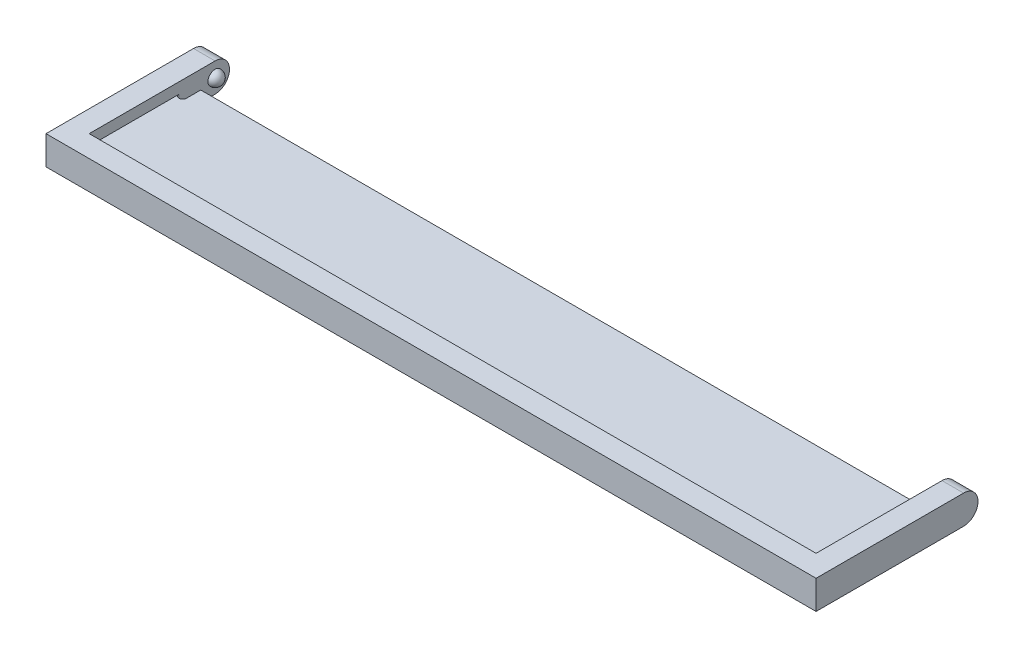
from build123d import *

# Parameters (mm, degrees)
SALIENTE_EXTRUIR1_DEPTH = 4
CROQUIS4_W              = 99
CROQUIS4_H              = 2
CORTAR_EXTRUIR1_DEPTH   = 10
REDONDEO1_R             = 2
CROQUIS5_W              = 101
CROQUIS5_H              = 16.071267716
CORTAR_EXTRUIR2_DEPTH   = 1.5


with BuildPart() as part:
    # Croquis1 → Saliente-Extruir1 (new body)
    with BuildSketch(Plane(origin=(0, 0, 0), x_dir=(1, 0, 0), z_dir=(0, 1, 0))):
        Polygon((-64.683943666, 30.054443615), (36.316056334, 30.054443615), (36.316056334, 33.054443615), (39.316056334, 33.054443615), (39.316056334, 30.054443615), (39.316056334, 10.554443615), (-67.683943666, 10.554443615), (-67.683943666, 30.054443615), (-67.683943666, 33.054443615), (-64.683943666, 33.054443615), align=None)
    extrude(amount=SALIENTE_EXTRUIR1_DEPTH)

    # Croquis4 → Cortar-Extruir1 (cut)
    with BuildSketch(Plane(origin=(0, 4, 0), x_dir=(1, 0, 0), z_dir=(0, 1, 0))):
        with Locations((-14.183943666, 29.054443615)):
            Rectangle(CROQUIS4_W, CROQUIS4_H)
        with BuildLine():
            Line((36.316056334, 26.054443615), (36.316056334, 30.054443615))
            Line((36.316056334, 30.054443615), (35.316056334, 30.054443615))
            Line((35.316056334, 30.054443615), (35.316056334, 28.054443615))
            Line((35.316056334, 28.054443615), (35.316056334, 26.054443615))
            ThreePointArc((35.316056334, 26.054443615), (35.816056334, 25.554443615), (36.316056334, 26.054443615))
        make_face()
        with BuildLine():
            Line((-63.683943666, 28.054443615), (-63.683943666, 30.054443615))
            Line((-63.683943666, 30.054443615), (-64.683943666, 30.054443615))
            Line((-64.683943666, 30.054443615), (-64.683943666, 26.054443615))
            ThreePointArc((-64.683943666, 26.054443615), (-64.183943666, 25.554443615), (-63.683943666, 26.054443615))
            Line((-63.683943666, 26.054443615), (-63.683943666, 28.054443615))
        make_face()
    extrude(amount=-CORTAR_EXTRUIR1_DEPTH, mode=Mode.SUBTRACT)

    # Redondeo1
    redondeo1_edges = [part.edges().sort_by_distance(p)[0] for p in [
        (-66.183943666, 0, -33.054443615),
        (-66.183943666, 4, -33.054443615),
        (37.816056334, 0, -33.054443615),
        (37.816056334, 4, -33.054443615),
    ]]
    fillet(redondeo1_edges, radius=REDONDEO1_R - 0.0001)  # a hair under: the kernel refuses the full size

    # Croquis3 → Revolución1 (revolve)
    with BuildSketch(Plane(origin=(-64.683943666, 0, 0), x_dir=(0, 0, -1), z_dir=(1, 0, 0))):
        with BuildLine():
            Line((32.054443615, 2), (30.054443615, 2))
            ThreePointArc((30.054443615, 2), (31.054443615, 1), (32.054443615, 2))
        make_face()
    revolve(axis=Axis((-64.683943666, 2, -32.054443615), (0, 0, 1)))

    # Croquis2 → Revolución2 (revolve)
    with BuildSketch(Plane.ZY.offset(-36.316056334)):
        with BuildLine():
            Line((-32.054443615, 2), (-30.054443615, 2))
            ThreePointArc((-30.054443615, 2), (-31.054443615, 1), (-32.054443615, 2))
        make_face()
    revolve(axis=Axis((36.316056334, 2, -32.054443615), (0, 0, 1)))

    # Croquis5 → Cortar-Extruir2 (cut)
    with BuildSketch(Plane(origin=(0, 4, 0), x_dir=(1, 0, 0), z_dir=(0, 1, 0))):
        with Locations((-14.183943666, 21.590077473)):
            Rectangle(CROQUIS5_W, CROQUIS5_H)
    extrude(amount=-CORTAR_EXTRUIR2_DEPTH, mode=Mode.SUBTRACT)


solid = part.part
